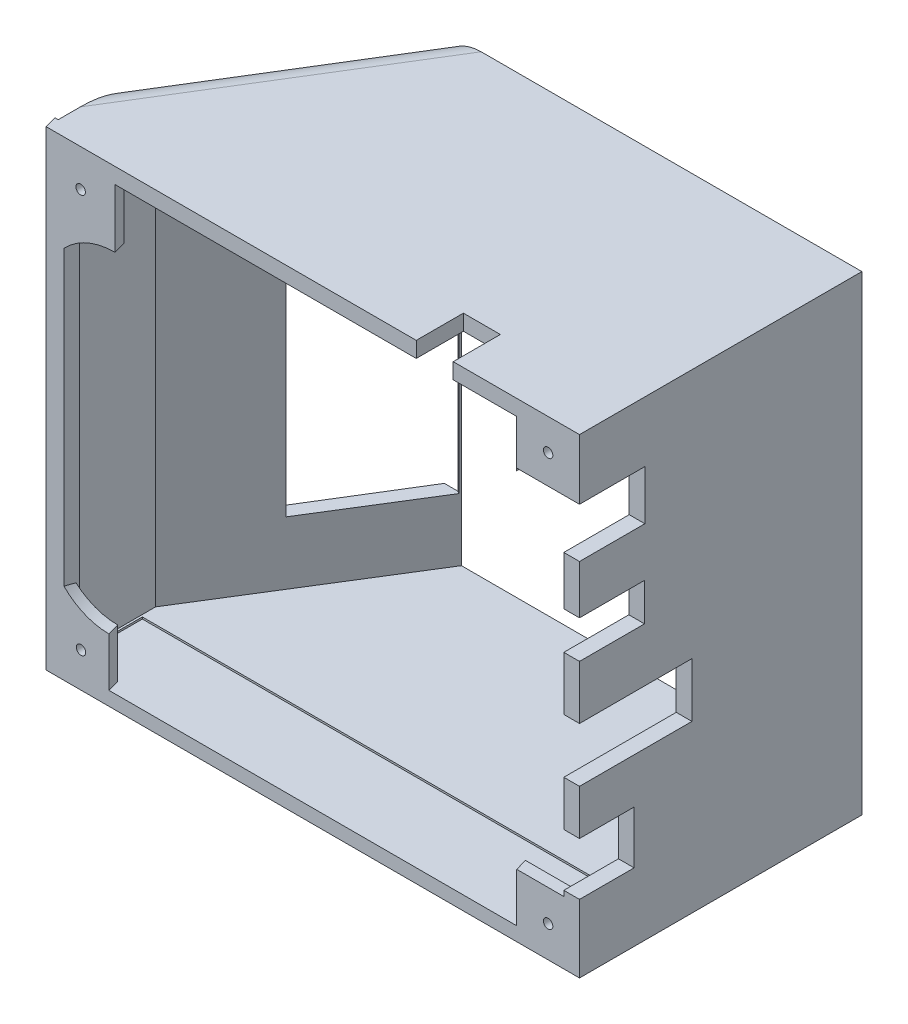
from build123d import *

# Parameters (mm, degrees)
ESBO_O1_W                  = 170
ESBO_O1_H                  = 30
RESSALTO_EXTRUS_O1_DEPTH   = 150
CORTE_EXTRUS_O1_DEPTH      = 222
CORTE_EXTRUS_O1_DEPTH_BACK = 36
RESSALTO_EXTRUS_O2_DEPTH   = 5
RESSALTO_EXTRUS_O3_DEPTH   = 5
ESBO_O4_W                  = 159.333333333
ESBO_O4_H                  = 140.588235294
CORTE_EXTRUS_O2_DEPTH      = 25
CORTE_EXTRUS_O3_DEPTH      = 31
CORTE_EXTRUS_O4_DEPTH      = 42
FILETE1_R                  = 10
CORTE_EXTRUS_O5_DEPTH      = 32
CORTE_EXTRUS_O6_START      = -15.72292277
CORTE_EXTRUS_O6_OUTLINE_R  = 3.95
CORTE_EXTRUS_O6_DEPTH      = 4.876648775
CORTE_EXTRUS_O7_START      = -132.751356438
CORTE_EXTRUS_O7_OUTLINE_R  = 3.95
CORTE_EXTRUS_O7_DEPTH      = 3.479370229
RESSALTO_EXTRUS_O6_DEPTH   = 17
RESSALTO_EXTRUS_O7_DEPTH   = 4
CORTE_EXTRUS_O8_DEPTH      = 21
F_3DSKETCH12_R             = 1.5
CORTE_EXTRUS_O9_DEPTH      = 14
CORTE_EXTRUS_O10_DEPTH     = 19
ESBO_O11_W                 = 17.407525744
ESBO_O11_H                 = 16.792397695
CORTE_EXTRUS_O11_DEPTH     = 10
CORTE_EXTRUS_O12_DEPTH     = 20
CORTE_EXTRUS_O13_DEPTH     = 14
CORTE_EXTRUS_O14_DEPTH     = 131


# Read off the part's stored shape, not the designer's step: Corte-extrusão6, Corte-extrusão7
with BuildPart() as part:
    # Esboço1 → Ressalto-extrusão1 (new body)
    with BuildSketch(Plane(origin=(0, 0, 0), x_dir=(1, 0, 0), z_dir=(0, 1, 0))):
        with Locations((85, 15)):
            Rectangle(ESBO_O1_W, ESBO_O1_H)
        Polygon((80, 160), (0, 30), (170, 30), (170, 160), align=None)
        Polygon((170, 160), (170, 185), (80, 160), align=None)
    extrude(amount=RESSALTO_EXTRUS_O1_DEPTH)

    # Esboço2 → Corte-extrusão1 (cut, two sides: drawn at the far end of the back side and taken through both)
    with BuildSketch(Plane(origin=(0, 0, 0), x_dir=(1, 0, 0), z_dir=(0, 1, 0)).offset(-CORTE_EXTRUS_O1_DEPTH_BACK)):
        Polygon((84.391050739, 157.608625205), (165, 180), (165, 5), (5, 5), (5, 29.866892941), align=None)
    extrude(amount=CORTE_EXTRUS_O1_DEPTH + CORTE_EXTRUS_O1_DEPTH_BACK, mode=Mode.SUBTRACT)

    # Esboço3 → Ressalto-extrusão2 (add)
    with BuildSketch(Plane(origin=(0, 0, 0), x_dir=(1, 0, 0), z_dir=(0, 1, 0))):
        Polygon((84.391050739, 157.608625205), (165, 180), (165, 5), (5, 5), (5, 29.866892941), align=None)
    extrude(amount=RESSALTO_EXTRUS_O2_DEPTH)

    # 3DSketch2 → Ressalto-extrusão3 (add)
    with BuildSketch(Plane(origin=(165, 150, -5), x_dir=(0, 0, -1), z_dir=(0, 1, 0))):
        Polygon((0, 0), (0, 160), (24.866892941, 160), (152.608625205, 80.608949261), (175, 0), align=None)
    extrude(amount=-RESSALTO_EXTRUS_O3_DEPTH)

    # Esboço4 → Corte-extrusão2 (cut)
    with BuildSketch(Plane.XY):
        with Locations((85.333333333, 74.705882353)):
            Rectangle(ESBO_O4_W, ESBO_O4_H)
    extrude(amount=-CORTE_EXTRUS_O2_DEPTH, mode=Mode.SUBTRACT)

    # 3DSketch3 → Corte-extrusão3 (cut)
    with BuildSketch(Plane(origin=(74.759025743, 90, -151.483416833), x_dir=(-0.29071694485714406, -0.8320502943378435, 0.4724150353928592), z_dir=(-0.8516583167045438, 0, -0.5240974256643346))):
        Polygon((0, 0), (22.188007849, 33.282011774), (72.111025509, 0), (49.92301766, -33.282011774), align=None)
    extrude(amount=-CORTE_EXTRUS_O3_DEPTH, mode=Mode.SUBTRACT)

    # 3DSketch4 → Corte-extrusão4 (cut)
    with BuildSketch(Plane(origin=(69.518051487, 130, -142.966833666), x_dir=(-0.37059284368967266, -0.7071067811865471, 0.6022133709956982), z_dir=(0.8516583167045362, 0, 0.5240974256643472))):
        Polygon((0, 0), (14.142135624, -14.142135624), (28.284271247, 0), (14.142135624, 14.142135624), align=None)
    extrude(amount=CORTE_EXTRUS_O4_DEPTH, mode=Mode.SUBTRACT)

    # Filete1
    filete1_edges = [part.edges().sort_by_distance(p)[0] for p in [
        (170, 75, -185),
        (125, 0, -172.5),
        (125, 150, -172.5),
        (80, 75, -160),
        (40, 0, -95),
        (40, 150, -95),
        (0, 75, -30),
        (84.391050739, 75, -157.608625205),
    ]]
    fillet(filete1_edges, radius=FILETE1_R)

    # 3DSketch5 → Corte-extrusão5 (cut)
    with BuildSketch(Plane(origin=(38.121221288, 25, -91.946984593), x_dir=(-0.194644897392922, 0.9284766908852593, 0.31629795826349816), z_dir=(0.851658316704544, 0, 0.5240974256643347))):
        Polygon((0, 0), (14.855627054, 37.139067635), (107.703296143, 0), (92.847669089, -37.139067635), align=None)
    extrude(amount=CORTE_EXTRUS_O5_DEPTH, mode=Mode.SUBTRACT)

    # Corte-extrusão6 outline → Corte-extrusão6 (cut)
    with BuildSketch(Plane(origin=(0, 0, 0), x_dir=(0.5240974256643349, 0, -0.8516583167045437), z_dir=(0.8516583167045437, 0, 0.5240974256643349)).offset(CORTE_EXTRUS_O6_START)):
        with Locations((148.193124726, 20)):
            Circle(CORTE_EXTRUS_O6_OUTLINE_R)
    extrude(amount=CORTE_EXTRUS_O6_DEPTH, mode=Mode.SUBTRACT)

    # Corte-extrusão7 outline → Corte-extrusão7 (cut)
    with BuildSketch(Plane(origin=(0, 0, 0), x_dir=(0.9635179096299408, 0, -0.267643863786094), z_dir=(0.267643863786094, 0, 0.9635179096299409)).offset(CORTE_EXTRUS_O7_START)):
        with Locations((161.993020775, 122.164347625)):
            Circle(CORTE_EXTRUS_O7_OUTLINE_R)
    extrude(amount=CORTE_EXTRUS_O7_DEPTH, mode=Mode.SUBTRACT)

    # 3DSketch9 → Ressalto-extrusão6 (add)
    with BuildSketch(Plane(origin=(76.350750718, 26, -154.069969916), x_dir=(-0.29815073011621673, 0.8224176546598938, 0.4844949364388514), z_dir=(0.8516583167045438, 0, 0.5240974256643349))):
        Polygon((0, 0), (26.758649409, 38.684123705), (82.683049926, 0), (55.924400517, -38.684123705), align=None)
        Polygon((5.017416454, 0.222210211), (27.772783339, 33.118916398), (77.117842619, -1.01413393), (54.362475733, -33.910840117), align=None, mode=Mode.SUBTRACT)
    extrude(amount=RESSALTO_EXTRUS_O6_DEPTH)

    # 3DSketch10 → Ressalto-extrusão7 (add, along a direction that is not the sketch's normal)
    with BuildSketch(Plane(origin=(0, 0, 0), x_dir=(0.7498378553650926, 0.6616216370868463, 0), z_dir=(0, 0, 1))):
        with BuildLine():
            Line((0, 0), (14.996757107, -13.232432742))
            Line((14.996757107, -13.232432742), (28.229189849, 1.764324366))
            ThreePointArc((28.229189849, 1.764324366), (21.556867541, 14.536675999), (25.141622209, 28.493838504))
            Line((25.141622209, 28.493838504), (13.232432742, 14.996757107))
            Line((13.232432742, 14.996757107), (0, 0))
        make_face()
        with BuildLine():
            Line((99.243245563, 112.475678305), (115.742930564, 97.917132715))
            Line((115.742930564, 97.917132715), (100.070543679, 80.155094246))
            ThreePointArc((100.070543679, 80.155094246), (86.055529464, 85.755516688), (71.66166921, 81.216558438))
            Line((71.66166921, 81.216558438), (83.570858678, 94.713639835))
            Line((83.570858678, 94.713639835), (99.243245563, 112.475678305))
        make_face()
        Polygon((226.715680975, 0), (211.718923868, 13.232432742), (198.486491126, -1.764324366), (213.483248233, -14.996757107), align=None)
        Polygon((127.472435412, -112.475678305), (112.475678305, -99.243245563), (125.708111047, -84.246488456), (140.704868154, -97.478921197), align=None)
    extrude(amount=-RESSALTO_EXTRUS_O7_DEPTH, dir=(0.26764386378609445, 0, 0.9635179096299407))

    # 3DSketch11 → Corte-extrusão8 (cut)
    with BuildSketch(Plane(origin=(153.100052242, 17.26943239, -180.305570067), x_dir=(-0.07376023038027929, 0.9970655099962036, 0.02048895288341091), z_dir=(0.2676438637860946, 0, 0.9635179096299407))):
        Polygon((0, 0), (0.269964353, 3.516152018), (46.066103253, 0), (45.7961389, -3.516152018), align=None)
    extrude(amount=CORTE_EXTRUS_O8_DEPTH, mode=Mode.SUBTRACT)

    # 3DSketch12 → Corte-extrusão9 (cut)
    with BuildSketch(Plane(origin=(160, 140, 0), x_dir=(-0.7560654573770964, -0.6544960077503622, 0), z_dir=(0, 0, 1))):
        with Locations(Location((0, 0, 0), (0, 0, 319.118554366))):
            Circle(F_3DSKETCH12_R)
        with Locations(Location((85.084481008, 98.288509459, 0), (0, 0, 319.118554366))):
            Circle(F_3DSKETCH12_R)
        with Locations(Location((113.858951537, -96.124361942, 0), (0, 0, 139.118554366))):
            Circle(F_3DSKETCH12_R)
        with Locations(Location((196.909602971, 0, 0), (0, 0, 139.118554366))):
            Circle(F_3DSKETCH12_R)
    extrude(amount=-CORTE_EXTRUS_O9_DEPTH, mode=Mode.SUBTRACT)

    # 3DSketch13 → Corte-extrusão10 (cut)
    with BuildSketch(Plane(origin=(170, 70.245878967, 0), x_dir=(0, -0.4354246522459521, -0.9002251786172678), z_dir=(-1, 0, 0))):
        Polygon((0, 0), (32.261446294, -15.604350297), (39.809023237, 0), (7.547576943, 15.604350297), align=None)
    extrude(amount=CORTE_EXTRUS_O10_DEPTH, mode=Mode.SUBTRACT)

    # Esboço11 → Corte-extrusão11 (cut)
    with BuildSketch(Plane(origin=(170, 0, 0), x_dir=(0, 0, -1), z_dir=(1, 0, 0))):
        with Locations((8.703762872, 30.096304842)):
            Rectangle(ESBO_O11_W, ESBO_O11_H)
    extrude(amount=-CORTE_EXTRUS_O11_DEPTH, mode=Mode.SUBTRACT)

    # 3DSketch14 → Corte-extrusão12 (cut)
    with BuildSketch(Plane(origin=(170, 87.396079578, 0), x_dir=(0, -0.09341146144778735, -0.9956275904524686), z_dir=(1, 0, 0))):
        Polygon((0, 0), (20.627912038, 1.935345533), (19.506160301, 13.891554783), (-1.121751737, 11.956209249), align=None)
        Polygon((-2.576084268, 27.457236328), (18.165947056, 29.403288726), (16.691971594, 45.113680317), (-4.050059731, 43.167627919), align=None)
        Polygon((91.534016736, 10.656116635), (99.096194716, 11.679615344), (100.676965661, 0), (93.114787682, -1.02349871), align=None)
    extrude(amount=-CORTE_EXTRUS_O12_DEPTH, mode=Mode.SUBTRACT)

    # 3DSketch15 → Corte-extrusão13 (cut)
    with BuildSketch(Plane(origin=(129.748977416, 150, 0), x_dir=(-0.6170578351280018, 0, -0.7869178026370631), z_dir=(0, -1, 0))):
        Polygon((0, 0), (11.819817446, 9.268453377), (19.087630878, 0), (7.267813432, -9.268453377), align=None)
    extrude(amount=CORTE_EXTRUS_O13_DEPTH, mode=Mode.SUBTRACT)

    # 3DSketch16 → Corte-extrusão14 (cut, along a direction that is not the sketch's normal)
    with BuildSketch(Plane(origin=(-4.487914591, 154.677224746, -90), x_dir=(0.7478301848964537, -0.6638900621019538, 0), z_dir=(0, 0, 1))):
        Polygon((0, 0), (133.725190167, 118.715219842), (239.115232272, 0), (105.390042105, -118.715219842), align=None)
    extrude(amount=-CORTE_EXTRUS_O14_DEPTH, dir=(-0.5240974256643347, 0, 0.8516583167045438), mode=Mode.SUBTRACT)


solid = part.part
